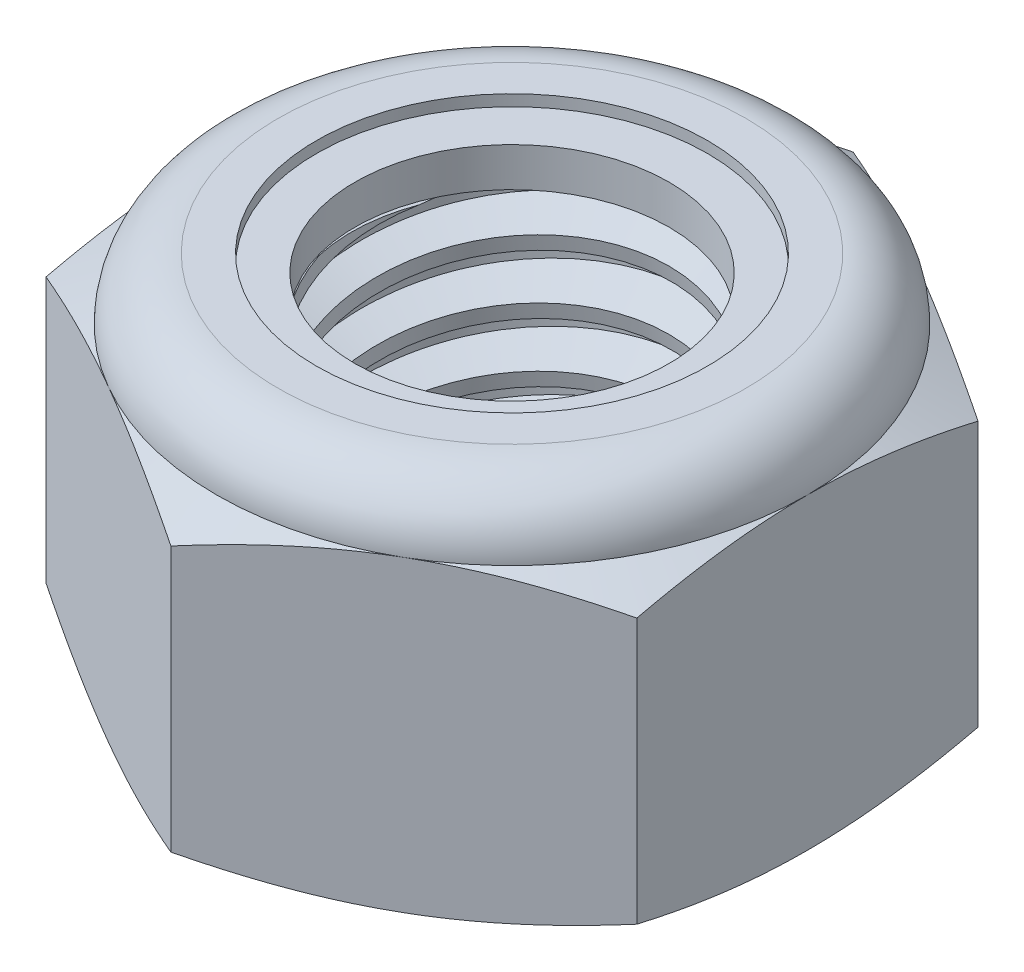
from build123d import *

# Parameters (mm, degrees)
EXTRUDE1_DEPTH       = 5
SKETCH2_W            = 2.5
SKETCH2_H            = 5
LPATTERN1_COUNT      = 6
LPATTERN1_PITCH      = 0.8
LPATTERN1_COUNT_DIR2 = 2
LPATTERN1_PITCH_DIR2 = 0.8


with BuildPart() as part:
    # Sketch1 → Extrude1 (new body)
    with BuildSketch(Plane(origin=(0, 0, 0), x_dir=(1, 0, 0), z_dir=(0, 1, 0))):
        Polygon((0, 4.618802154), (-4, 2.309401077), (-4, -2.309401077), (0, -4.618802154), (4, -2.309401077), (4, 2.309401077), align=None)
    extrude(amount=EXTRUDE1_DEPTH)

    # Sketch4 → Cut-Revolve2 (revolve, cut)
    with BuildSketch(Plane(origin=(0, 0, 0), x_dir=(0, 0, -1), z_dir=(1, 0, 0))):
        Polygon((0, 5), (2.5, 5), (2.127722339, 4.826404076), (2.127722339, 0.173595924), (2.5, 0), (0, 0), align=None)
    revolve(axis=Axis((0, 5, 0), (0, 1, 0)), mode=Mode.SUBTRACT)


with BuildPart() as body_2:
    # Sketch2 → Revolve1 (revolve)
    with BuildSketch(Plane(origin=(0, 0, 0), x_dir=(0, 0, -1), z_dir=(1, 0, 0))):
        with Locations((1.25, 2.5)):
            Rectangle(SKETCH2_W, SKETCH2_H)
    revolve(axis=Axis((0, -2.5, 0), (0, 1, 0)))

    # Sketch3 → Cut-Revolve1 (revolve, cut)
    with BuildSketch(Plane(origin=(0, 0, 0), x_dir=(0, 0, -1), z_dir=(1, 0, 0))):
        Polygon((2.51579905, 4.901255937), (2.626392401, 4.210047494), (2.15932044, 4.388495759), (2.127722339, 4.585983885), align=None)
    cut_revolve1 = revolve(axis=Axis((0, 5, 0.136915776), (0, -0.9874406319167054, -0.15799050110667298)), mode=Mode.SUBTRACT)

    # LPattern1: Cut-Revolve1 6 × 2
    with Locations(*[Vector(0, -1, 0) * (i * LPATTERN1_PITCH) + Vector(0, 1, 0) * (j * LPATTERN1_PITCH_DIR2) for i in range(LPATTERN1_COUNT) for j in range(LPATTERN1_COUNT_DIR2) if (i, j) != (0, 0)]):
        add(cut_revolve1, mode=Mode.SUBTRACT)


with BuildPart() as part_1:
    add(part.part)

    # Combine1: cut body 2
    add(body_2.part, mode=Mode.SUBTRACT)

    # Sketch5 → Cut-Revolve3 (revolve, cut)
    with BuildSketch(Plane(origin=(0, 0, 0), x_dir=(0, 0, -1), z_dir=(1, 0, 0))):
        with BuildLine():
            Line((0, 0), (4, 0))
            Line((4, 0), (4.618802154, 0.288552183))
            Line((4.618802154, 0.288552183), (4.618802154, 3.878114484))
            Line((4.618802154, 3.878114484), (4, 4.166666667))
            ThreePointArc((4, 4.166666667), (3.755922318, 4.755922318), (3.166666667, 5))
            Line((3.166666667, 5), (3.166666667, 6.27))
            Line((3.166666667, 6.27), (5.888802154, 6.27))
            Line((5.888802154, 6.27), (5.888802154, -1.27))
            Line((5.888802154, -1.27), (0, -1.27))
            Line((0, -1.27), (0, 0))
        make_face()
    revolve(axis=Axis((0, 0, 0), (0, 1, 0)), mode=Mode.SUBTRACT)

    # Sketch6 → Cut-Revolve4 (revolve, cut)
    with BuildSketch(Plane(origin=(0, 0, 0), x_dir=(0, 0, -1), z_dir=(1, 0, 0))):
        with BuildLine():
            Line((0, 4.166666667), (3.8476, 4.166666667))
            ThreePointArc((3.8476, 4.166666667), (3.648159244, 4.648159244), (3.166666667, 4.8476))
            Line((3.166666667, 4.8476), (2.647194503, 4.8476))
            Line((2.647194503, 4.8476), (2.647194503, 6.27))
            Line((2.647194503, 6.27), (0, 6.27))
            Line((0, 6.27), (0, 4.166666667))
        make_face()
    revolve(axis=Axis((0, 6.27, 0), (0, 1, 0)), mode=Mode.SUBTRACT)


with BuildPart() as body_2_2:
    # Sketch7 → Revolve2 (revolve)
    with BuildSketch(Plane(origin=(0, 0, 0), x_dir=(0, 0, -1), z_dir=(1, 0, 0))):
        with BuildLine():
            Line((2.127722339, 4.242866667), (3.766579964, 4.242866667))
            ThreePointArc((3.766579964, 4.242866667), (3.566430175, 4.620419399), (3.166666667, 4.7714))
            Line((3.166666667, 4.7714), (2.127722339, 4.7714))
            Line((2.127722339, 4.7714), (2.127722339, 4.242866667))
        make_face()
    revolve(axis=Axis((0, 4.242866667, 0), (0, 1, 0)))


solid = Compound([part_1.part, body_2_2.part])
